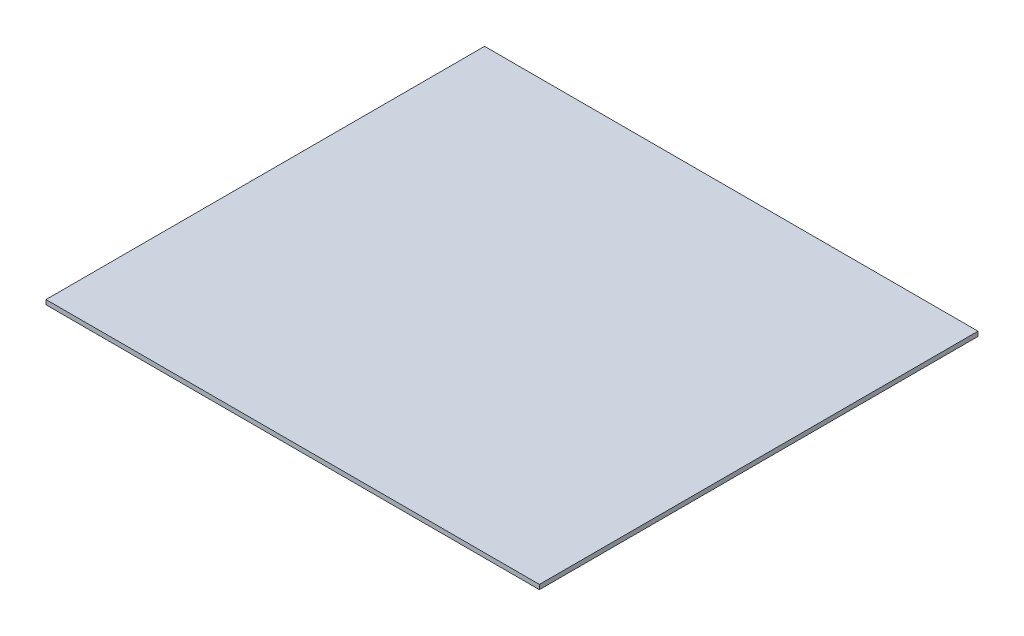
from build123d import *

# Parameters (mm, degrees)
SKETCH1_W           = 685.8
SKETCH1_H           = 609.6
BOSS_EXTRUDE1_DEPTH = 6.35


with BuildPart() as part:
    # Sketch1 → Boss-Extrude1 (new body)
    with BuildSketch(Plane(origin=(0, 0, 0), x_dir=(1, 0, 0), z_dir=(0, 1, 0))):
        with Locations((55.678811881, -69.862574257)):
            Rectangle(SKETCH1_W, SKETCH1_H)
    extrude(amount=BOSS_EXTRUDE1_DEPTH)


solid = part.part
